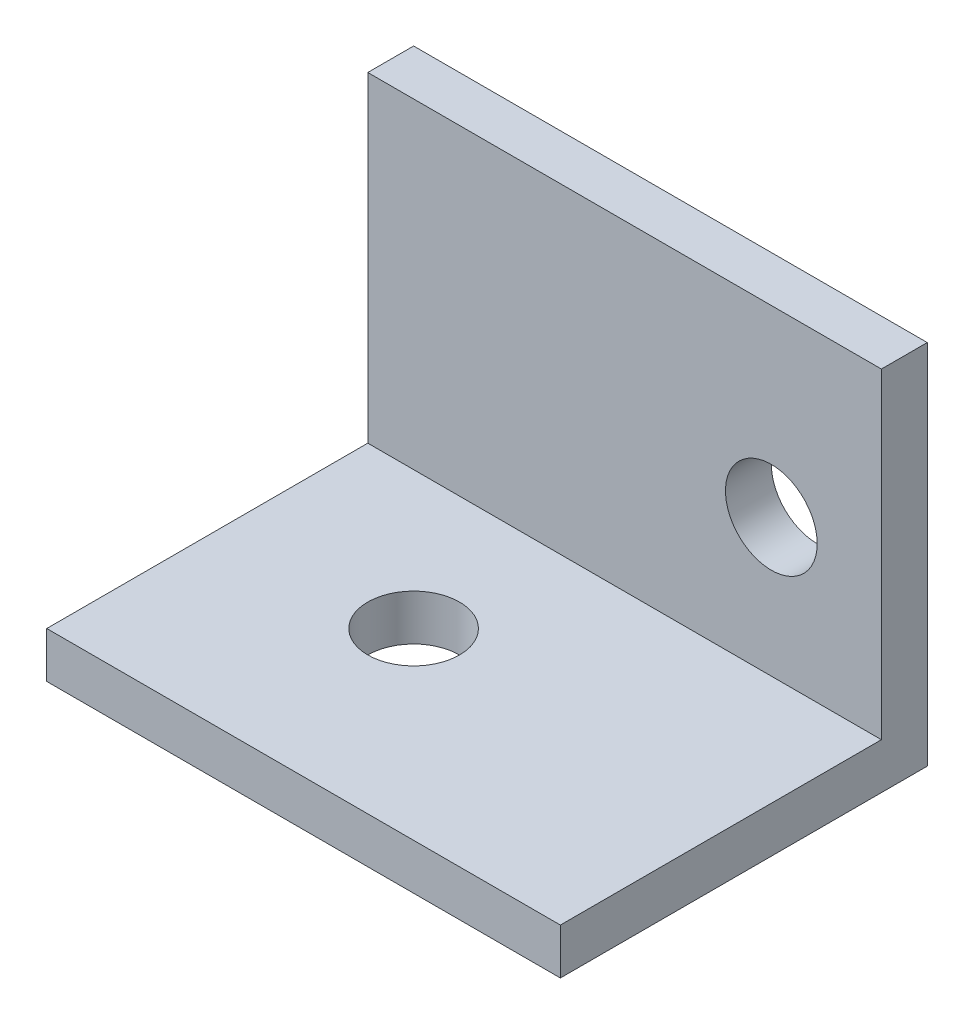
from build123d import *

# Parameters (mm, degrees)
SKETCH1_W           = 35.56
SKETCH1_H           = 25.4
BOSS_EXTRUDE1_DEPTH = 3.175
SKETCH2_W           = 35.56
SKETCH2_H           = 3.175
BOSS_EXTRUDE2_DEPTH = 22.225
SKETCH3_R           = 3.175
CUT_EXTRUDE1_DEPTH  = 3.175
SKETCH4_R           = 3.175
CUT_EXTRUDE2_DEPTH  = 3.175


with BuildPart() as part:
    # Sketch1 → Boss-Extrude1 (new body)
    with BuildSketch(Plane(origin=(0, 0, 0), x_dir=(1, 0, 0), z_dir=(0, 1, 0))):
        Rectangle(SKETCH1_W, SKETCH1_H)
    extrude(amount=BOSS_EXTRUDE1_DEPTH)

    # Sketch2 → Boss-Extrude2 (add)
    with BuildSketch(Plane(origin=(0, 3.175, 0), x_dir=(1, 0, 0), z_dir=(0, 1, 0))):
        with Locations((0, 11.1125)):
            Rectangle(SKETCH2_W, SKETCH2_H)
    extrude(amount=BOSS_EXTRUDE2_DEPTH)

    # Sketch3 → Cut-Extrude1 (cut)
    with BuildSketch(Plane(origin=(0, 3.175, 0), x_dir=(1, 0, 0), z_dir=(0, 1, 0))):
        with Locations((-5.08, 0)):
            Circle(SKETCH3_R)
    extrude(amount=-CUT_EXTRUDE1_DEPTH, mode=Mode.SUBTRACT)

    # Sketch4 → Cut-Extrude2 (cut)
    with BuildSketch(Plane.XY.offset(-9.525)):
        with Locations((10.16, 12.7)):
            Circle(SKETCH4_R)
    extrude(amount=-CUT_EXTRUDE2_DEPTH, mode=Mode.SUBTRACT)


solid = part.part
